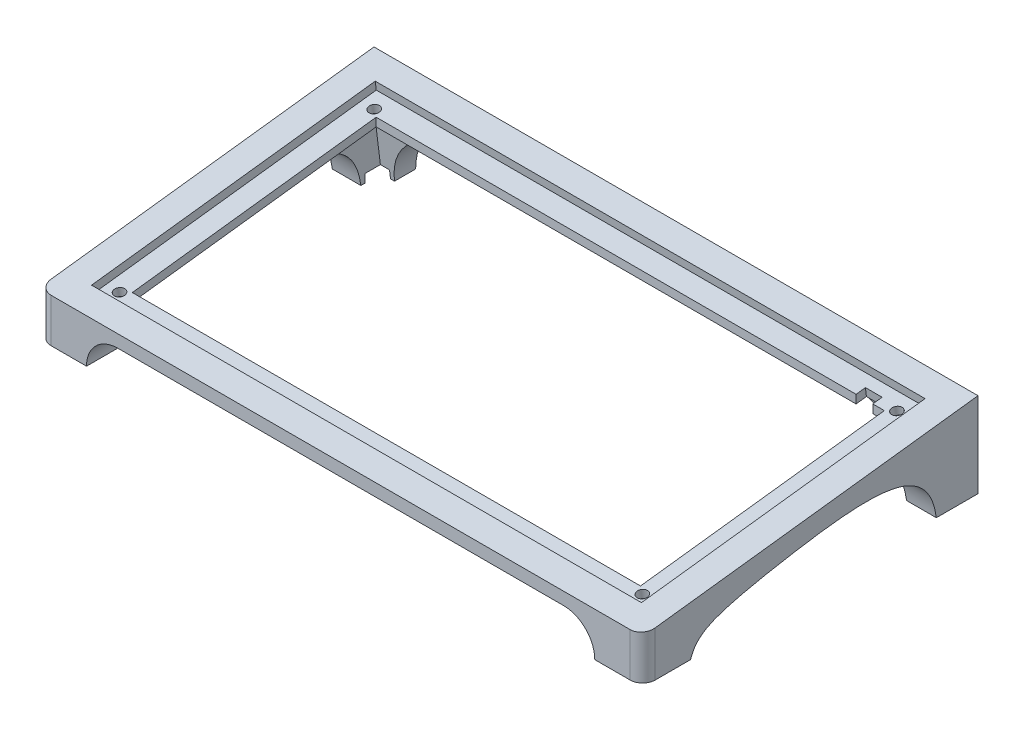
from build123d import *

# Parameters (mm, degrees)
BOSS_EXTRUDE1_DEPTH       = 17.38
BOSS_EXTRUDE1_DEPTH_BACK  = 3
SKETCH1_W                 = 145
SKETCH1_H                 = 80.5
SKETCH1_W_2               = 132
SKETCH1_H_2               = 68.1
SKETCH2_W                 = 145.621836594
SKETCH2_H                 = 81.229894902
CUT_EXTRUDE1_DEPTH        = 10.38
FILLET1_R                 = 3
BOSS_EXTRUDE17_DEPTH      = 17.38
BOSS_EXTRUDE17_DEPTH_BACK = 3
SKETCH5_W                 = 132
SKETCH5_H                 = 68.1
SKETCH5_W_2               = 122
SKETCH5_H_2               = 58.53632086
SKETCH9_W                 = 144.471640976
SKETCH9_H                 = 84.136143584
CUT_EXTRUDE5_DEPTH        = 9.6
SKETCH6_W                 = 132
SKETCH6_H                 = 68.611419114
CUT_EXTRUDE6_DEPTH        = 2
CUT_EXTRUDE9_DEPTH        = 10.7
CUT_EXTRUDE12_START       = -145
CUT_EXTRUDE12_DEPTH       = 145
CUT_EXTRUDE13_DEPTH       = 10
SKETCH21_W                = 131
SKETCH21_H                = 67.1
CUT_EXTRUDE14_DEPTH       = 30
CUT_EXTRUDE15_START       = -2
CUT_EXTRUDE15_DEPTH       = 2
CUT_EXTRUDE17_DEPTH       = 10
CUT_EXTRUDE18_DEPTH       = 10


# Read off the part's stored shape, not the designer's step: Cut-Extrude12, Cut-Extrude15
with BuildPart() as part:
    # Sketch1 → Boss-Extrude1 (new, two sides: drawn at the far end of the back side and taken through both)
    with BuildSketch(Plane(origin=(0, 0, 0), x_dir=(1, 0, 0), z_dir=(0, 1, 0)).offset(-BOSS_EXTRUDE1_DEPTH_BACK)):
        Rectangle(SKETCH1_W, SKETCH1_H)
        Rectangle(SKETCH1_W_2, SKETCH1_H_2, mode=Mode.SUBTRACT)
    extrude(amount=BOSS_EXTRUDE1_DEPTH + BOSS_EXTRUDE1_DEPTH_BACK)

    # Sketch2 → Cut-Extrude1 (cut)
    with BuildSketch(Plane(origin=(0, 12.253191712, 1.504502764), x_dir=(-1, 0, 0), z_dir=(0, 0.9925461516413239, 0.12186934340513403))):
        with Locations((0.310918297, -1.453124341)):
            Rectangle(SKETCH2_W, SKETCH2_H)
    extrude(amount=CUT_EXTRUDE1_DEPTH, mode=Mode.SUBTRACT)

    # Fillet1
    fillet1_edges = [part.edges().sort_by_distance(p)[0] for p in [
        (72.5, 2.247921424, 40.25),
        (-72.5, 2.247921424, 40.25),
    ]]
    fillet(fillet1_edges, radius=FILLET1_R)

    # Sketch5 → Boss-Extrude17 (add, two sides: drawn at the far end of the back side and taken through both)
    with BuildSketch(Plane(origin=(0, 0, 0), x_dir=(1, 0, 0), z_dir=(0, 1, 0)).offset(-BOSS_EXTRUDE17_DEPTH_BACK)):
        Rectangle(SKETCH5_W, SKETCH5_H)
        Rectangle(SKETCH5_W_2, SKETCH5_H_2, mode=Mode.SUBTRACT)
    extrude(amount=BOSS_EXTRUDE17_DEPTH + BOSS_EXTRUDE17_DEPTH_BACK)

    # Sketch9 → Cut-Extrude5 (cut)
    with BuildSketch(Plane(origin=(0, 12.253191712, 1.504502764), x_dir=(1, 0, 0), z_dir=(0, 0.9925461516413238, 0.12186934340513406))):
        Rectangle(SKETCH9_W, SKETCH9_H)
    extrude(amount=CUT_EXTRUDE5_DEPTH, mode=Mode.SUBTRACT)

    # Sketch6 → Cut-Extrude6 (cut)
    with BuildSketch(Plane(origin=(0, 12.253191712, 1.504502764), x_dir=(-1, 0, 0), z_dir=(0, 0.9925461516413239, 0.12186934340513403))):
        with Locations((0, -1.515801317)):
            Rectangle(SKETCH6_W, SKETCH6_H)
    extrude(amount=-CUT_EXTRUDE6_DEPTH, mode=Mode.SUBTRACT)

    # Sketch12 → Cut-Extrude9 (cut)
    with BuildSketch(Plane(origin=(0, 0, -40.25), x_dir=(-1, 0, 0), z_dir=(0, 0, -1))):
        with BuildLine():
            Line((62.5, -3), (62.500586031, -3))
            ThreePointArc((62.500586031, -3), (58.288781544, 7.168195513), (48.120586031, 11.38))
            Line((48.120586031, 11.38), (0, 11.38))
            Line((0, 11.38), (-48.120586031, 11.38))
            ThreePointArc((-48.120586031, 11.38), (-58.288781544, 7.168195513), (-62.500586031, -3))
            Line((-62.500586031, -3), (62.5, -3))
        make_face()
    extrude(amount=-CUT_EXTRUDE9_DEPTH, mode=Mode.SUBTRACT)

    # Cut-Extrude12 outline → Cut-Extrude12 (cut)
    with BuildSketch(Plane.ZY.offset(72.5).offset(CUT_EXTRUDE12_START)):
        with BuildLine():
            Line((-30.25, -3), (28.75, -3))
            add(Edge.make_bspline(
                [(28.75, -3), (26.32968346, 4.271531969), (19.440941834, 4.451750453), (-1.874181617, 6.089281656), (-27.421780079, 18.432975247), (-30.25, -3)],
                knots=[0.042214979, 0.042214979, 0.042214979, 0.042214979, 0.042214979, 0.042214979, 1.042214979, 1.042214979, 1.042214979, 1.042214979, 1.042214979, 1.042214979], degree=5))
        make_face()
    extrude(amount=CUT_EXTRUDE12_DEPTH, mode=Mode.SUBTRACT)

    # Sketch19 → Cut-Extrude13 (cut)
    with BuildSketch(Plane(origin=(0, 10.268099409, 1.260764077), x_dir=(1, 0, 0), z_dir=(0, 0.9925461516413238, 0.12186934340513403))):
        with BuildLine():
            ThreePointArc((61.5, 32.0425), (61.866116524, 31.158616524), (62.75, 30.7925))
            Line((62.75, 30.7925), (62.75, 32.0425))
            Line((62.75, 32.0425), (61.5, 32.0425))
        make_face()
        with BuildLine():
            Line((62.75, 32.0425), (62.75, 30.7925))
            ThreePointArc((62.75, 30.7925), (63.633883476, 31.158616524), (64, 32.0425))
            ThreePointArc((64, 32.0425), (62.75, 33.2925), (61.5, 32.0425))
            Line((61.5, 32.0425), (62.75, 32.0425))
        make_face()
        with BuildLine():
            ThreePointArc((64, -29.5425), (63.633883476, -28.658616524), (62.75, -28.2925))
            Line((62.75, -28.2925), (62.75, -29.5425))
            Line((62.75, -29.5425), (61.5, -29.5425))
            ThreePointArc((61.5, -29.5425), (62.75, -30.7925), (64, -29.5425))
        make_face()
        with BuildLine():
            Line((62.75, -29.5425), (62.75, -28.2925))
            ThreePointArc((62.75, -28.2925), (61.866116524, -28.658616524), (61.5, -29.5425))
            Line((61.5, -29.5425), (62.75, -29.5425))
        make_face()
        with BuildLine():
            ThreePointArc((-61.5, -29.5425), (-61.866116524, -28.658616524), (-62.75, -28.2925))
            Line((-62.75, -28.2925), (-62.75, -29.5425))
            Line((-62.75, -29.5425), (-61.5, -29.5425))
        make_face()
        with BuildLine():
            Line((-62.75, -29.5425), (-62.75, -28.2925))
            ThreePointArc((-62.75, -28.2925), (-63.633883476, -30.426383476), (-61.5, -29.5425))
            Line((-61.5, -29.5425), (-62.75, -29.5425))
        make_face()
        with BuildLine():
            ThreePointArc((-61.5, 32.0425), (-63.633883476, 32.926383476), (-62.75, 30.7925))
            Line((-62.75, 30.7925), (-62.75, 32.0425))
            Line((-62.75, 32.0425), (-61.5, 32.0425))
        make_face()
        with BuildLine():
            Line((-62.75, 32.0425), (-62.75, 30.7925))
            ThreePointArc((-62.75, 30.7925), (-61.866116524, 31.158616524), (-61.5, 32.0425))
            Line((-61.5, 32.0425), (-62.75, 32.0425))
        make_face()
    extrude(amount=-CUT_EXTRUDE13_DEPTH, mode=Mode.SUBTRACT)

    # Sketch21 → Cut-Extrude14 (cut)
    with BuildSketch(Plane(origin=(0, 8.283007106, 1.01702539), x_dir=(1, 0, 0), z_dir=(0, 0.9925461516413238, 0.12186934340513403))):
        with Locations((-0.141032576, 0.996407471)):
            Rectangle(SKETCH21_W, SKETCH21_H)
    extrude(amount=-CUT_EXTRUDE14_DEPTH, mode=Mode.SUBTRACT)

    # Cut-Extrude15 outline → Cut-Extrude15 (cut)
    with BuildSketch(Plane(origin=(0, -3, 0), x_dir=(-1, 0, 0), z_dir=(0, -1, 0)).offset(CUT_EXTRUDE15_START)):
        with BuildLine():
            Line((67.499992595, -31.228634541), (63.449992595, -31.228634541))
            Line((63.449992595, -31.228634541), (63.449992595, -35.278634541))
            ThreePointArc((63.449992595, -35.278634541), (70.363775058, -38.142417005), (67.499992595, -31.228634541))
        make_face()
        with BuildLine():
            Line((63.449999996, 31.2), (67.499999996, 31.2))
            ThreePointArc((67.499999996, 31.2), (70.363782459, 38.113782464), (63.449999996, 35.25))
            Line((63.449999996, 35.25), (63.449999996, 31.2))
        make_face()
        with BuildLine():
            Line((-67.5, 31.2), (-63.45, 31.2))
            Line((-63.45, 31.2), (-63.45, 35.25))
            ThreePointArc((-63.45, 35.25), (-70.363782464, 38.113782464), (-67.5, 31.2))
        make_face()
        with BuildLine():
            Line((-63.45, -31.2), (-67.5, -31.2))
            ThreePointArc((-67.5, -31.2), (-70.363782464, -38.113782464), (-63.45, -35.25))
            Line((-63.45, -35.25), (-63.45, -31.2))
        make_face()
    extrude(amount=CUT_EXTRUDE15_DEPTH, mode=Mode.SUBTRACT)

    # Sketch25 → Cut-Extrude17 (cut)
    with BuildSketch(Plane(origin=(0, 8.283007106, 1.01702539), x_dir=(1, 0, 0), z_dir=(0, -0.9925461516413238, -0.1218693434051341))):
        Polygon((58.22, -33.01262228), (58.22, -32.0425), (58.22, -30.51262228), (54.22, -30.51262228), (54.22, -33.01262228), align=None)
    extrude(amount=-CUT_EXTRUDE17_DEPTH, mode=Mode.SUBTRACT)

    # Sketch26 → Cut-Extrude18 (cut)
    with BuildSketch(Plane.XY.offset(40.25)):
        with BuildLine():
            ThreePointArc((-53.509718644, 4.495842847), (-58.810079952, 2.300361308), (-61.005561492, -3))
            Line((-61.005561492, -3), (-61, -3))
            Line((-61, -3), (59.5, -3))
            Line((59.5, -3), (61.005561492, -3))
            ThreePointArc((61.005561492, -3), (58.810079952, 2.300361308), (53.509718644, 4.495842847))
            Line((53.509718644, 4.495842847), (53.241634956, 4.495842847))
            Line((53.241634956, 4.495842847), (0, 4.495842847))
            Line((0, 4.495842847), (-53.509718644, 4.495842847))
        make_face()
    extrude(amount=-CUT_EXTRUDE18_DEPTH, mode=Mode.SUBTRACT)


solid = part.part
